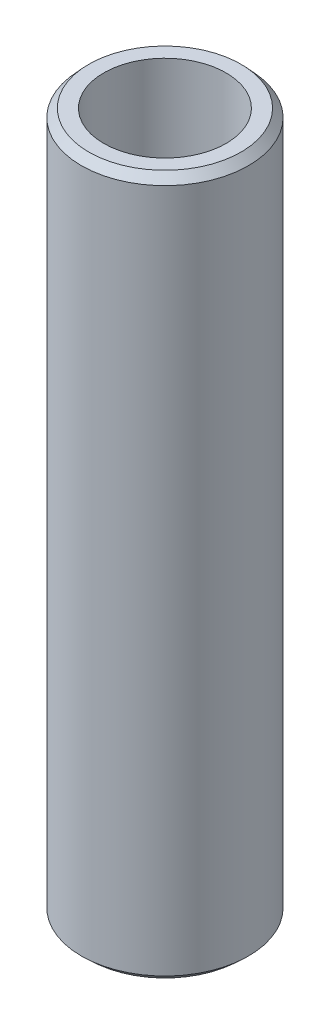
from build123d import *
from OCP.BRepFilletAPI import BRepFilletAPI_MakeChamfer

# Parameters (mm, degrees)
SKETCH1_R           = 60
BOSS_EXTRUDE1_DEPTH = 502.652044758
SKETCH2_R           = 43.930638038
CUT_EXTRUDE1_DEPTH  = 510.763747337
CHAMFER1_SIZE       = 5.788842519
CHAMFER1_SIZE2      = 5.331003684


with BuildPart() as part:
    # Sketch1 → Boss-Extrude1 (new body)
    with BuildSketch(Plane(origin=(0, 0, 0), x_dir=(1, 0, 0), z_dir=(0, 1, 0))):
        Circle(SKETCH1_R)
    extrude(amount=BOSS_EXTRUDE1_DEPTH)

    # Sketch2 → Cut-Extrude1 (cut, through all)
    with BuildSketch(Plane(origin=(0, 0, 0), x_dir=(1, 0, 0), z_dir=(0, 1, 0))):
        Circle(SKETCH2_R)
    extrude(amount=CUT_EXTRUDE1_DEPTH, mode=Mode.SUBTRACT)

    # Chamfer1: one chamfer whose edges measure the first distance from different faces: ONE call of the kernel's chamfer builder (chamfer() names one face for all edges)
    chamfer1_edges_1 = [part.edges().sort_by_distance(p)[0] for p in [
        (-60, 502.652044758, 0),
    ]]
    chamfer1_side_1 = [part.faces().sort_by_distance(p)[0] for p in [
        (-60, 251.326022379, 0),
    ]]
    chamfer1_edges_2 = [part.edges().sort_by_distance(p)[0] for p in [
        (-60, 0, 0),
    ]]
    chamfer1_side_2 = [part.faces().sort_by_distance(p)[0] for p in [
        (-58.302943725, 0, 0),
    ]]
    chamfer1 = BRepFilletAPI_MakeChamfer(part.part.solid().wrapped)
    for e in chamfer1_edges_1:
        chamfer1.Add(CHAMFER1_SIZE, CHAMFER1_SIZE2, e.wrapped, chamfer1_side_1[0].wrapped)  # the first distance lies on this face
    for e in chamfer1_edges_2:
        chamfer1.Add(CHAMFER1_SIZE, CHAMFER1_SIZE2, e.wrapped, chamfer1_side_2[0].wrapped)  # the first distance lies on this face
    add(Compound.cast(chamfer1.Shape()), mode=Mode.REPLACE)


solid = part.part
